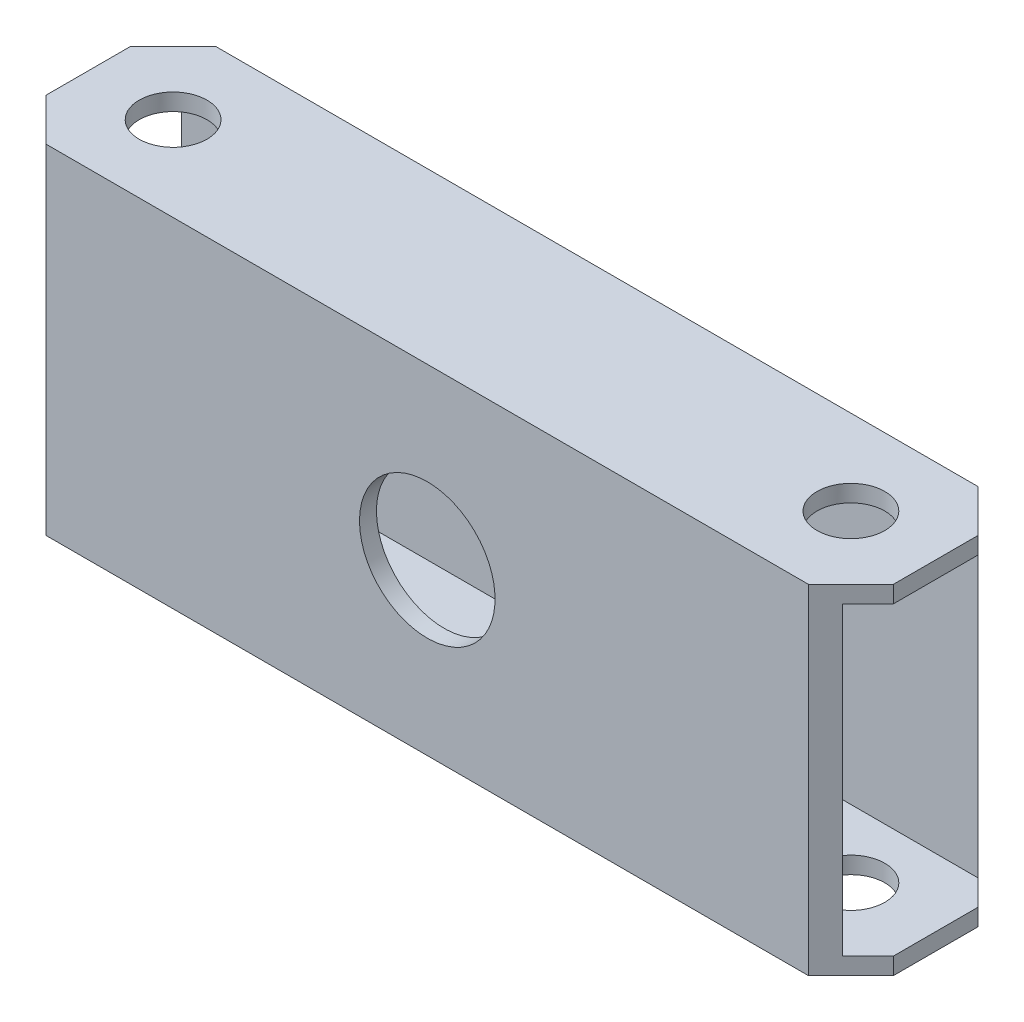
from build123d import *

# Parameters (mm, degrees)
SKETCH1_W           = 100
SKETCH1_H           = 20
BOSS_EXTRUDE1_DEPTH = 40
SKETCH2_R           = 4
CUT_EXTRUDE1_DEPTH  = 110.544511501
SKETCH3_R           = 8
CUT_EXTRUDE2_DEPTH  = 110.544511501
CUT_EXTRUDE3_DEPTH  = 109.480412979
CHAMFER1_SIZE       = 5


with BuildPart() as part:
    # Sketch1 → Boss-Extrude1 (new body)
    with BuildSketch(Plane(origin=(0, 0, 0), x_dir=(1, 0, 0), z_dir=(0, 1, 0))):
        with Locations((50, 10)):
            Rectangle(SKETCH1_W, SKETCH1_H)
    extrude(amount=BOSS_EXTRUDE1_DEPTH)

    # Sketch2 → Cut-Extrude1 (cut, through all)
    with BuildSketch(Plane(origin=(0, 40, 0), x_dir=(1, 0, 0), z_dir=(0, 1, 0))):
        with Locations(Location((10, 10, 0), (0, 0, 270))):
            Circle(SKETCH2_R)
        with Locations(Location((90, 10, 0), (0, 0, 270))):
            Circle(SKETCH2_R)
    extrude(amount=-CUT_EXTRUDE1_DEPTH, mode=Mode.SUBTRACT)

    # Sketch3 → Cut-Extrude2 (cut, through all)
    with BuildSketch(Plane(origin=(0, 0, -20), x_dir=(-1, 0, 0), z_dir=(0, 0, -1))):
        with Locations((-50, 20)):
            Circle(SKETCH3_R)
    extrude(amount=-CUT_EXTRUDE2_DEPTH, mode=Mode.SUBTRACT)

    # 3DSketch1 → Cut-Extrude3 (cut, through all)
    with BuildSketch(Plane(origin=(100, 38, -18), x_dir=(0, -0.913811548620257, 0.4061384660534479), z_dir=(-1, 0, 0))):
        Polygon((0, 0), (6.498215457, 14.620984778), (39.395431207, 0), (32.89721575, -14.620984778), align=None)
    extrude(amount=CUT_EXTRUDE3_DEPTH, mode=Mode.SUBTRACT)

    # Chamfer1
    # the kernel refuses this chamfer: 5 mm, written as the material it takes off along each edge
    with BuildSketch(Plane(origin=(100, -12.85841494, -20), x_dir=(0.0274958766105877, 0, 0.9996219169112968), z_dir=(0, 1, 0)), Plane(origin=(100, -12.85841494, 0), x_dir=(-0.9996219169112968, 0, 0.027495876610586334), z_dir=(0, 1, 0))) as chamfer1_piece_1:
        Polygon((CHAMFER1_SIZE * 0.999621916911, -CHAMFER1_SIZE * 0.0274958766106), (-CHAMFER1_SIZE * 0.0274958766106, -CHAMFER1_SIZE * 0.999621916911), (0, 0), align=None)
    extrude(amount=65.71682988, mode=Mode.SUBTRACT)
    with BuildSketch(Plane(origin=(0, -12.85841494, -20), x_dir=(-0.027495876610586372, 0, 0.9996219169112968), z_dir=(0, 1, 0)), Plane(origin=(0, -12.85841494, 0), x_dir=(0.9996219169112968, 0, 0.027495876610586372), z_dir=(0, 1, 0))) as chamfer1_piece_2:
        Polygon((CHAMFER1_SIZE * 0.999621916911, CHAMFER1_SIZE * 0.0274958766106), (-CHAMFER1_SIZE * 0.0274958766106, CHAMFER1_SIZE * 0.999621916911), (0, 0), align=None)
    extrude(amount=65.71682988, mode=Mode.SUBTRACT)


solid = part.part
